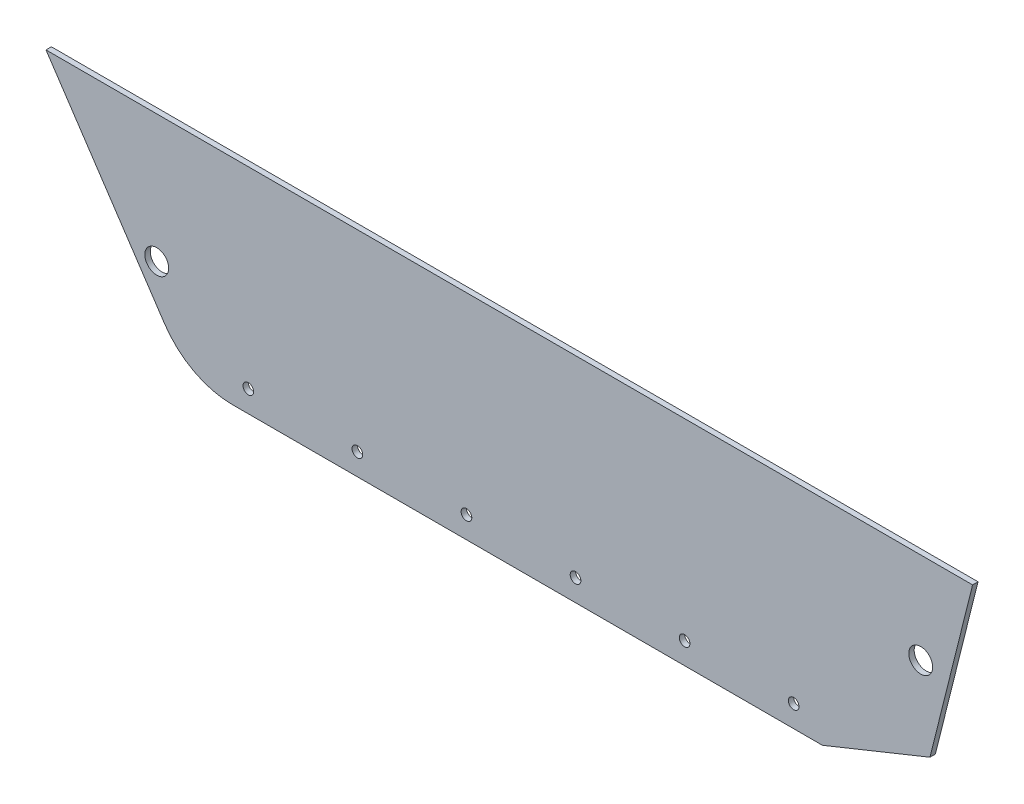
from build123d import *

# Parameters (mm, degrees)
BOSS_EXTRUDE1_DEPTH = 3.175
SKETCH1_4_R         = 3.125
CUT_EXTRUDE1_DEPTH  = 439.905857431
FILLET1_R           = 48
CUT_EXTRUDE3_DEPTH  = 10
CUT_EXTRUDE5_REACH  = 440.906
SKETCH11_R          = 7
SKETCH13_R          = 7
CUT_EXTRUDE6_DEPTH  = 10


with BuildPart() as part:
    # Sketch1 → Boss-Extrude1 (new body)
    with BuildSketch(Plane.XY):
        Polygon((-98.879411765, 3.850980392), (-31.879411765, -96.649019608), (366, -96.649019608), (403.120588235, -71.149019608), (428.120588235, 28.939617947), (-115.605170134, 28.939617947), align=None)
    extrude(amount=BOSS_EXTRUDE1_DEPTH)

    # Sketch1<4> → Cut-Extrude1 (cut, through all)
    with BuildSketch(Plane.XY):
        with Locations((3.120588235, -83.899019608)):
            Circle(SKETCH1_4_R)
        with Locations((67.120588235, -83.899019608)):
            Circle(SKETCH1_4_R)
        with Locations((131.120588235, -83.899019608)):
            Circle(SKETCH1_4_R)
        with Locations((195.120588235, -83.899019608)):
            Circle(SKETCH1_4_R)
        with Locations((259.120588235, -83.899019608)):
            Circle(SKETCH1_4_R)
        with Locations((323.120588235, -83.899019608)):
            Circle(SKETCH1_4_R)
    extrude(amount=CUT_EXTRUDE1_DEPTH, mode=Mode.SUBTRACT)

    # Fillet1
    fillet1_edges = [part.edges().sort_by_distance(p)[0] for p in [
        (-31.879411765, -96.649019608, 1.5875),
    ]]
    fillet(fillet1_edges, radius=FILLET1_R)

    # Sketch7 → Cut-Extrude3 (cut)
    with BuildSketch(Plane.XY.offset(3.175)):
        Polygon((403.120588235, -71.149019608), (340.005873473, -96.649019608), (366, -96.649019608), align=None)
    extrude(amount=-CUT_EXTRUDE3_DEPTH, mode=Mode.SUBTRACT)

    # Sketch11 → Cut-Extrude5 (cut, up to next)
    with BuildSketch(Plane(origin=(0, 0, 0), x_dir=(-1, 0, 0), z_dir=(0, 0, -1)), mode=Mode.PRIVATE) as cut_extrude5_sk1:
        with Locations((-397.678558137, -24.610405219)):
            Circle(SKETCH11_R)
    cut_extrude5_tool1 = extrude(cut_extrude5_sk1.sketch, amount=-CUT_EXTRUDE5_REACH, mode=Mode.PRIVATE) & part.part
    add(cut_extrude5_tool1.solids().sort_by_distance((397.678558, -24.610405, 0))[0], mode=Mode.SUBTRACT)

    # Sketch13 → Cut-Extrude6 (cut)
    with BuildSketch(Plane(origin=(0, 0, 0), x_dir=(-1, 0, 0), z_dir=(0, 0, -1))):
        with Locations((50.605170134, -46.060382053)):
            Circle(SKETCH13_R)
    extrude(amount=-CUT_EXTRUDE6_DEPTH, mode=Mode.SUBTRACT)


solid = part.part
